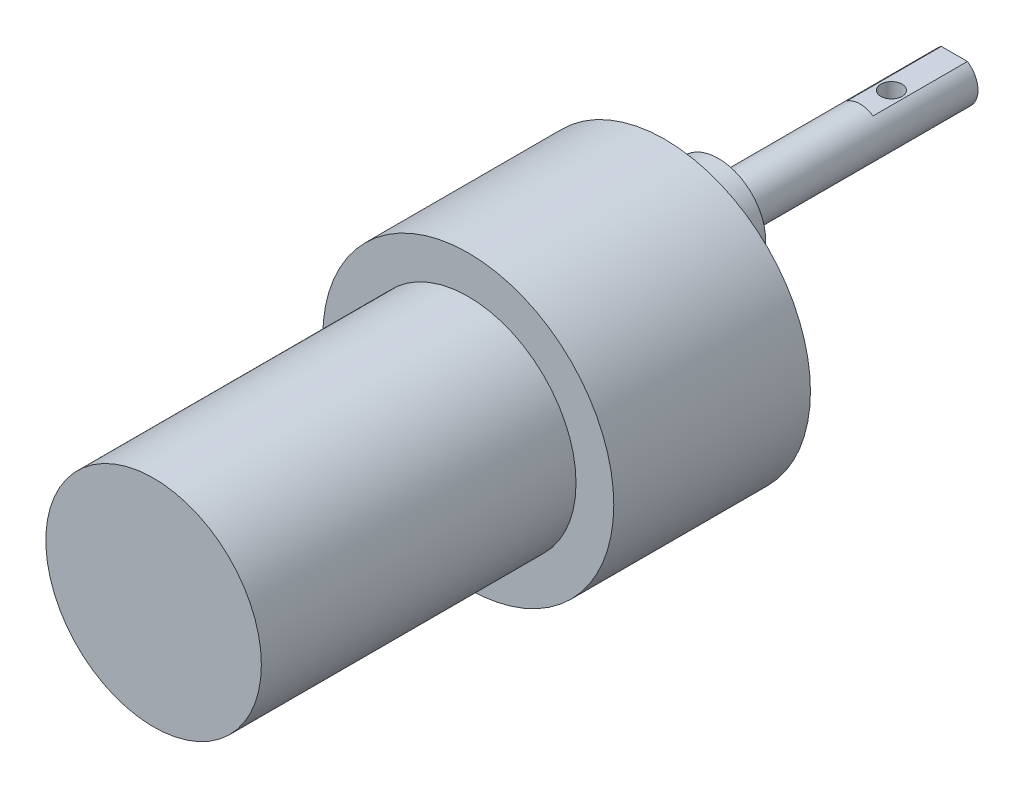
from build123d import *

# Parameters (mm, degrees)
SKETCH1_R           = 18.5
BOSS_EXTRUDE1_DEPTH = 25
SKETCH2_R           = 6
BOSS_EXTRUDE2_DEPTH = 6.8
SKETCH3_R           = 3
BOSS_EXTRUDE3_DEPTH = 30
CUT_EXTRUDE1_DEPTH  = 12
SKETCH5_R           = 13.7
BOSS_EXTRUDE4_DEPTH = 40
SKETCH6_R           = 1.5
CUT_EXTRUDE2_DEPTH  = 3.2
THREAD1_PITCH       = 1.058333333
SKETCH7_R           = 1.350457069
CUT_EXTRUDE3_DEPTH  = 10


with BuildPart() as part:
    # Sketch1 → Boss-Extrude1 (new body)
    with BuildSketch(Plane.XY):
        Circle(SKETCH1_R)
    extrude(amount=BOSS_EXTRUDE1_DEPTH)

    # Sketch2 → Boss-Extrude2 (add)
    with BuildSketch(Plane(origin=(0, 0, 0), x_dir=(-1, 0, 0), z_dir=(0, 0, -1))):
        with Locations(Location((0, 7, 0), (0, 0, 180))):
            Circle(SKETCH2_R)
    extrude(amount=BOSS_EXTRUDE2_DEPTH)

    # Sketch3 → Boss-Extrude3 (add)
    with BuildSketch(Plane(origin=(0, 0, -6.8), x_dir=(-1, 0, 0), z_dir=(0, 0, -1))):
        with Locations((0, 7)):
            Circle(SKETCH3_R)
    extrude(amount=BOSS_EXTRUDE3_DEPTH)

    # Sketch4 → Cut-Extrude1 (cut)
    with BuildSketch(Plane(origin=(0, 0, -36.8), x_dir=(-1, 0, 0), z_dir=(0, 0, -1))):
        Polygon((-80.661429966, 9.5), (-1.658312395, 9.5), (1.658312395, 9.5), (80.661429966, 9.5), (80.661429966, 167.506235142), (-80.661429966, 167.506235142), align=None)
    extrude(amount=-CUT_EXTRUDE1_DEPTH, mode=Mode.SUBTRACT)

    # Sketch5 → Boss-Extrude4 (add)
    with BuildSketch(Plane.XY.offset(25)):
        Circle(SKETCH5_R)
    extrude(amount=BOSS_EXTRUDE4_DEPTH)

    # Sketch6 → Cut-Extrude2 (cut)
    with BuildSketch(Plane(origin=(0, 0, 0), x_dir=(-1, 0, 0), z_dir=(0, 0, -1))):
        with Locations((-15.75, 0)):
            Circle(SKETCH6_R)
        with Locations((-7.875, 13.63990011)):
            Circle(SKETCH6_R)
        with Locations((7.875, 13.63990011)):
            Circle(SKETCH6_R)
        with Locations((15.75, 0)):
            Circle(SKETCH6_R)
        with Locations((7.875, -13.63990011)):
            Circle(SKETCH6_R)
        with Locations((-7.875, -13.63990011)):
            Circle(SKETCH6_R)
    extrude(amount=-CUT_EXTRUDE2_DEPTH, mode=Mode.SUBTRACT)

    # Thread1: the profile of Thread Profile1 profile screwed along a right-hand helix of 3.023622 turns, 8 arcs to a turn; built about Z, then put on its axis
    thread1_z = Axis((0, 0, 0), (0, 0, 1))
    thread1_corners = [(1.5003, 0, -0.000173205), (1.5003, 0, 0.926214869), (0.927160282, 0, 0.595312499), (0.927160282, 0, 0.330729165)]
    with BuildLine(mode=Mode.PRIVATE) as thread1_profile:
        Line(thread1_corners[0], thread1_corners[1])
        Line(thread1_corners[1], thread1_corners[2])
        Line(thread1_corners[2], thread1_corners[3])
        Line(thread1_corners[3], thread1_corners[0])
    thread1_cap = Face(thread1_profile.wire())
    thread1_turn_angles = [0, 22.5, 45, 67.5, 90, 112.5, 135, 157.5, 180, 202.5, 225, 247.5, 270, 292.5, 315, 337.5, 360]
    thread1_turn_weights = [1, 0.9238795325112867, 1, 0.9238795325112867, 1, 0.9238795325112867, 1, 0.9238795325112867, 1, 0.9238795325112867, 1, 0.9238795325112867, 1, 0.9238795325112867, 1, 0.9238795325112867, 1]
    thread1_turn_rails = [Edge.make_bspline([Vector(p[0], p[1], 0).rotate(thread1_z, thread1_turn_angles[k]) / thread1_turn_weights[k] + Vector(0, 0, p[2] + THREAD1_PITCH * thread1_turn_angles[k] / 360) for k in range(17)], [0, 0, 0, 1, 1, 2, 2, 3, 3, 4, 4, 5, 5, 6, 6, 7, 7, 8, 8, 8], 2, thread1_turn_weights) for p in thread1_corners]
    thread1_turn_sides = [Face.make_surface_from_curves(thread1_turn_rails[p[0]], thread1_turn_rails[p[1]]) for p in [(0, 1), (1, 2), (2, 3), (3, 0)]]
    thread1_last_angles = [1080, 1084.251968504, 1088.503937008]
    thread1_last_weights = [1, 0.9972476383747746, 1]
    thread1_last_rails = [Edge.make_bspline([Vector(p[0], p[1], 0).rotate(thread1_z, thread1_last_angles[k]) / thread1_last_weights[k] + Vector(0, 0, p[2] + THREAD1_PITCH * thread1_last_angles[k] / 360) for k in range(3)], [0, 0, 0, 1, 1, 1], 2, thread1_last_weights) for p in thread1_corners]
    thread1_last_sides = [Face.make_surface_from_curves(thread1_last_rails[p[0]], thread1_last_rails[p[1]]) for p in [(0, 1), (1, 2), (2, 3), (3, 0)]]
    thread1 = Plane(origin=(15.75, 0, 0), x_dir=(1, 0, 0), z_dir=(0, 0, 1)) * Solid(Shell([*[p.moved(Location((0, 0, THREAD1_PITCH * i))) for i in range(3) for p in thread1_turn_sides], *thread1_last_sides, thread1_cap, thread1_cap.rotate(thread1_z, 1088.503937008).moved(Location((0, 0, THREAD1_PITCH * 1088.503937008 / 360)))]))
    add(thread1)

    # Sketch7 → Cut-Extrude3 (cut)
    with BuildSketch(Plane(origin=(0, 9.5, 0), x_dir=(1, 0, 0), z_dir=(0, 1, 0))):
        with Locations(Location((0, 28.8, 0), (0, 0, 270))):
            Circle(SKETCH7_R)
    extrude(amount=-CUT_EXTRUDE3_DEPTH, mode=Mode.SUBTRACT)


solid = part.part
